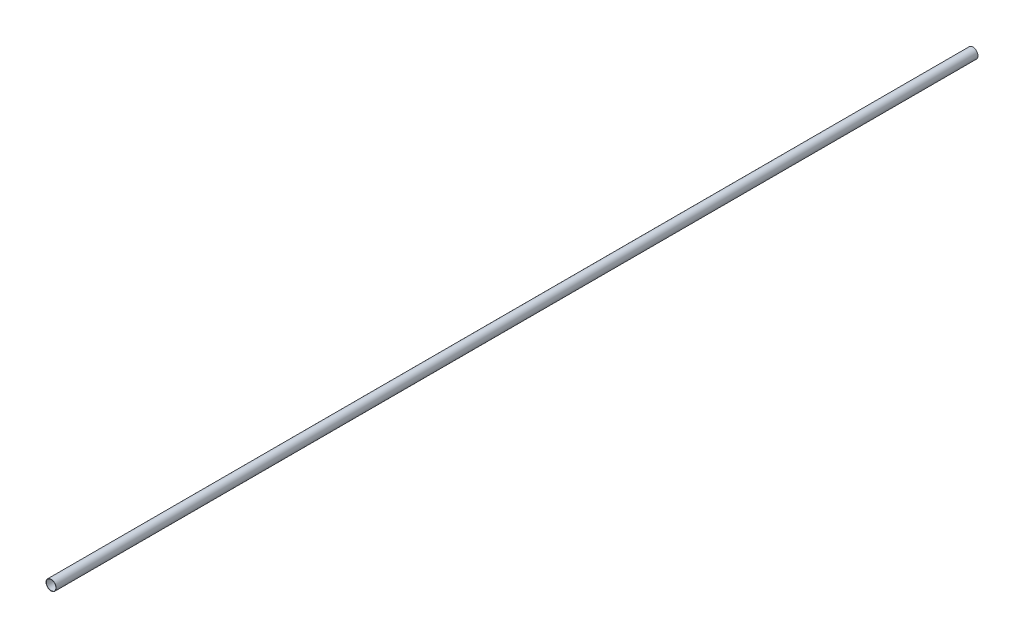
from build123d import *

# Parameters (mm, degrees)
SKETCH1_R           = 4.572
SKETCH1_R_2         = 4.318
BOSS_EXTRUDE1_DEPTH = 825.5


with BuildPart() as part:
    # Sketch1 → Boss-Extrude1 (new body)
    with BuildSketch(Plane.XY):
        with Locations((-116.372970926, -116.372970926)):
            Circle(SKETCH1_R)
        with Locations((-116.372970926, -116.372970926)):
            Circle(SKETCH1_R_2, mode=Mode.SUBTRACT)
    extrude(amount=BOSS_EXTRUDE1_DEPTH)


solid = part.part
